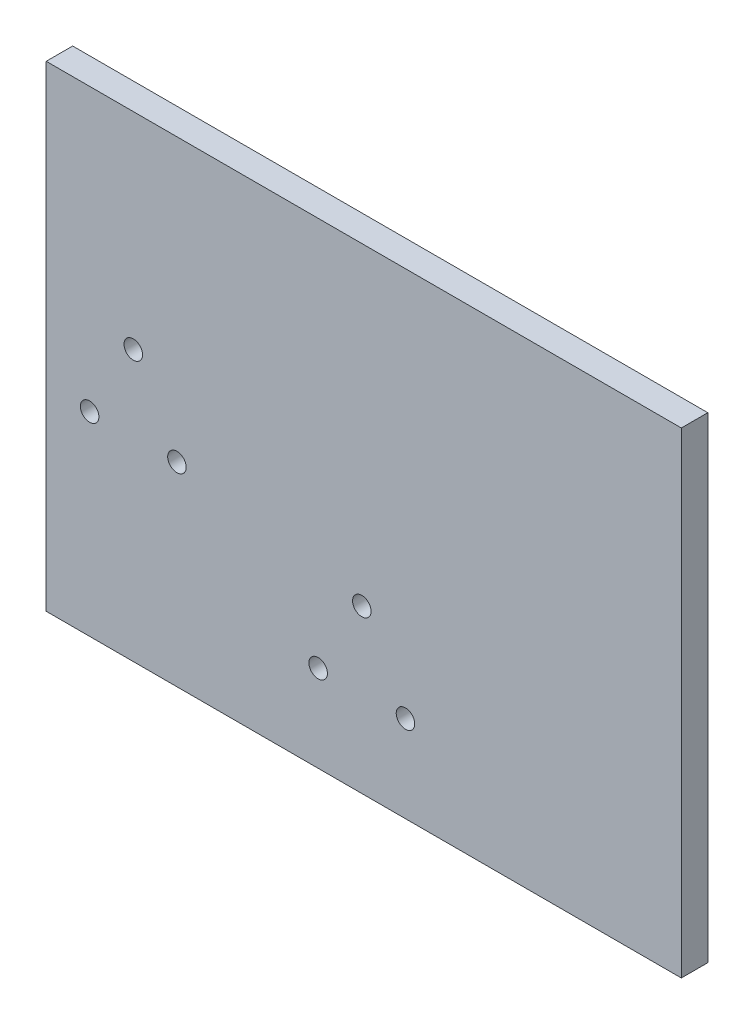
from build123d import *

# Parameters (mm, degrees)
SKETCH_1_W          = 120
SKETCH_1_H          = 90
EXTRUDE_1_DEPTH     = 5
SKETCH_3_R          = 1.75
CUT_EXTRUDE_1_DEPTH = 10


with BuildPart() as part:
    # 草图1 → 凸台-拉伸1 (new body)
    with BuildSketch(Plane.XY):
        Rectangle(SKETCH_1_W, SKETCH_1_H)
    extrude(amount=EXTRUDE_1_DEPTH)

    # 草图3 → 切除-拉伸1 (cut)
    with BuildSketch(Plane(origin=(0, 0, 0), x_dir=(-1, 0, 0), z_dir=(0, 0, -1))):
        with Locations((43.550433762, 6.067082821)):
            Circle(SKETCH_3_R)
        with Locations((0.36794908, -14.325)):
            Circle(SKETCH_3_R)
        with Locations((51.799325733, -8.220417179)):
            Circle(SKETCH_3_R)
        with Locations((35.301541791, -8.220417179)):
            Circle(SKETCH_3_R)
        with Locations((8.616841051, -28.6125)):
            Circle(SKETCH_3_R)
        with Locations((-7.880942891, -28.6125)):
            Circle(SKETCH_3_R)
    extrude(amount=-CUT_EXTRUDE_1_DEPTH, mode=Mode.SUBTRACT)


solid = part.part
